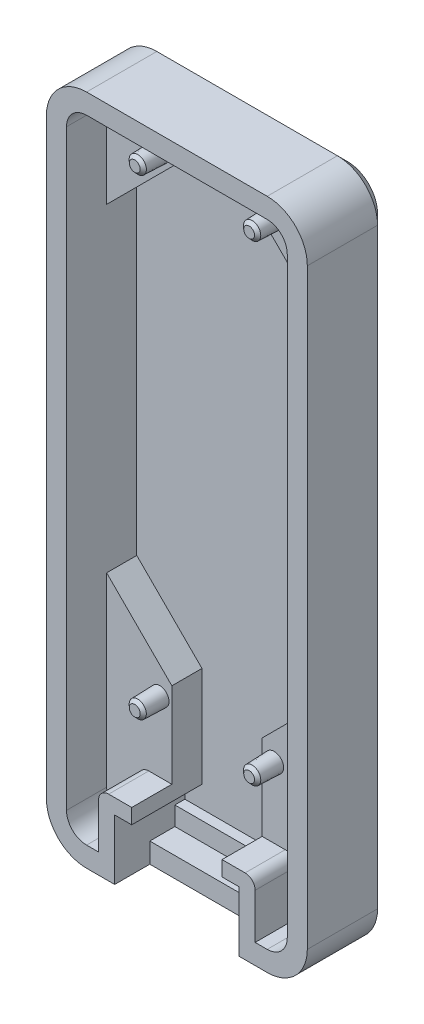
from build123d import *

# Parameters (mm, degrees)
BOSS_EXTRUDE1_DEPTH = 8
BOSS_EXTRUDE2_DEPTH = 1
SKETCH3_W           = 12.400024414
SKETCH3_H           = 1.862224361
BOSS_EXTRUDE3_DEPTH = 1
SKETCH6_R           = 0.85
SKETCH5_R           = 1.004760965
SKETCH5_4_R         = 1.00476126
SKETCH6_4_R         = 0.85
SKETCH6_6_R         = 0.85
SKETCH5_6_R         = 1.004762062
CHAMFER1_SIZE       = 0.3
CHAMFER1_SIZE_2     = 0.310868543
CHAMFER1_SIZE_3     = 0.304224899
CHAMFER1_SIZE_4     = 0.310868565
CHAMFER1_SIZE_5     = 0.310868624
CHAMFER2_SIZE       = 1
SKETCH7_W           = 12.400024414
SKETCH7_H           = 3.5
CUT_EXTRUDE1_DEPTH  = 3
BOSS_EXTRUDE4_DEPTH = 2


with BuildPart() as part:
    # Sketch1 → Boss-Extrude1 (new body)
    with BuildSketch(Plane.XY):
        with BuildLine():
            Line((162.000045776, 76.259460449), (144.000045776, 76.259460449))
            ThreePointArc((144.000045776, 76.259460449), (141.171618652, 77.431033324), (140.000045776, 80.259460449))
            Line((140.000045776, 80.259460449), (140.000045776, 139.259460449))
            ThreePointArc((140.000045776, 139.259460449), (141.171618652, 142.087887574), (144.000045776, 143.259460449))
            Line((144.000045776, 143.259460449), (162.000045776, 143.259460449))
            ThreePointArc((162.000045776, 143.259460449), (164.828472901, 142.087887574), (166.000045776, 139.259460449))
            Line((166.000045776, 139.259460449), (166.000045776, 80.259460449))
            ThreePointArc((166.000045776, 80.259460449), (164.828472901, 77.431033324), (162.000045776, 76.259460449))
        make_face()
        with BuildLine():
            Line((162.000045776, 78.259460449), (160.800048828, 78.259460449))
            Line((160.800048828, 78.259460449), (160.800048828, 82.759460449))
            ThreePointArc((160.800048828, 82.759460449), (160.507155609, 83.46656723), (159.800048828, 83.759460449))
            Line((159.800048828, 83.759460449), (157.500045776, 83.759460449))
            Line((157.500045776, 83.759460449), (157.500045776, 82.259460449))
            Line((157.500045776, 82.259460449), (159.200057983, 82.259460449))
            Line((159.200057983, 82.259460449), (159.200057983, 78.259460449))
            Line((159.200057983, 78.259460449), (146.800033569, 78.259460449))
            Line((146.800033569, 78.259460449), (146.800033569, 82.259460449))
            Line((146.800033569, 82.259460449), (148.500045776, 82.259460449))
            Line((148.500045776, 82.259460449), (148.500045776, 83.759460449))
            Line((148.500045776, 83.759460449), (146.200042725, 83.759460449))
            ThreePointArc((146.200042725, 83.759460449), (145.492935943, 83.46656723), (145.200042725, 82.759460449))
            Line((145.200042725, 82.759460449), (145.200042725, 78.259460449))
            Line((145.200042725, 78.259460449), (144.000045776, 78.259460449))
            ThreePointArc((144.000045776, 78.259460449), (142.585832214, 78.845246887), (142.000045776, 80.259460449))
            Line((142.000045776, 80.259460449), (142.000045776, 139.259460449))
            ThreePointArc((142.000045776, 139.259460449), (142.585832214, 140.673674012), (144.000045776, 141.259460449))
            Line((144.000045776, 141.259460449), (162.000045776, 141.259460449))
            ThreePointArc((162.000045776, 141.259460449), (163.414259339, 140.673674012), (164.000045776, 139.259460449))
            Line((164.000045776, 139.259460449), (164.000045776, 80.259460449))
            ThreePointArc((164.000045776, 80.259460449), (163.414259339, 78.845246887), (162.000045776, 78.259460449))
        make_face(mode=Mode.SUBTRACT)
    extrude(amount=BOSS_EXTRUDE1_DEPTH)

    # Sketch2 → Boss-Extrude2 (add)
    with BuildSketch(Plane(origin=(0, 0, 0), x_dir=(-1, 0, 0), z_dir=(0, 0, -1))):
        with BuildLine():
            Line((-140.000045776, 80.259460449), (-140.000045776, 139.259460449))
            ThreePointArc((-140.000045776, 139.259460449), (-141.171618652, 142.087887574), (-144.000045776, 143.259460449))
            Line((-144.000045776, 143.259460449), (-162.000045776, 143.259460449))
            ThreePointArc((-162.000045776, 143.259460449), (-164.828472901, 142.087887574), (-166.000045776, 139.259460449))
            Line((-166.000045776, 139.259460449), (-166.000045776, 80.259460449))
            ThreePointArc((-166.000045776, 80.259460449), (-164.828472901, 77.431033324), (-162.000045776, 76.259460449))
            Line((-162.000045776, 76.259460449), (-144.000045776, 76.259460449))
            ThreePointArc((-144.000045776, 76.259460449), (-141.171618652, 77.431033324), (-140.000045776, 80.259460449))
        make_face()
    extrude(amount=-BOSS_EXTRUDE2_DEPTH)

    # Sketch3 → Boss-Extrude3 (add)
    with BuildSketch(Plane.XY.offset(1)):
        with BuildLine():
            Line((142.000045776, 130.561752319), (151.345153809, 139.906860352))
            Line((151.345153809, 139.906860352), (154.654937744, 139.906860352))
            Line((154.654937744, 139.906860352), (164.000045776, 130.561736378))
            Line((164.000045776, 130.561736378), (164.000045776, 139.259460449))
            ThreePointArc((164.000045776, 139.259460449), (163.414259339, 140.673674012), (162.000045776, 141.259460449))
            Line((162.000045776, 141.259460449), (144.000045776, 141.259460449))
            ThreePointArc((144.000045776, 141.259460449), (142.585832214, 140.673674012), (142.000045776, 139.259460449))
            Line((142.000045776, 139.259460449), (142.000045776, 130.561752319))
        make_face()
        with BuildLine():
            Line((142.000045776, 98.75945232), (148.500045776, 92.259460449))
            Line((148.500045776, 92.259460449), (148.500045776, 83.759460449))
            Line((148.500045776, 83.759460449), (146.200042725, 83.759460449))
            ThreePointArc((146.200042725, 83.759460449), (145.492935943, 83.46656723), (145.200042725, 82.759460449))
            Line((145.200042725, 82.759460449), (145.200042725, 78.259460449))
            Line((145.200042725, 78.259460449), (144.000045776, 78.259460449))
            ThreePointArc((144.000045776, 78.259460449), (142.585832214, 78.845246887), (142.000045776, 80.259460449))
            Line((142.000045776, 80.259460449), (142.000045776, 98.75945232))
        make_face()
        with BuildLine():
            Line((164.000045776, 80.259460449), (164.000045776, 98.759468579))
            Line((164.000045776, 98.759468579), (157.500045776, 92.259460449))
            Line((157.500045776, 92.259460449), (157.500045776, 83.759460449))
            Line((157.500045776, 83.759460449), (159.800048828, 83.759460449))
            ThreePointArc((159.800048828, 83.759460449), (160.507155609, 83.46656723), (160.800048828, 82.759460449))
            Line((160.800048828, 82.759460449), (160.800048828, 78.259460449))
            Line((160.800048828, 78.259460449), (162.000045776, 78.259460449))
            ThreePointArc((162.000045776, 78.259460449), (163.414259339, 78.845246887), (164.000045776, 80.259460449))
        make_face()
        with Locations((153.000045776, 79.190572629)):
            Rectangle(SKETCH3_W, SKETCH3_H)
    extrude(amount=BOSS_EXTRUDE3_DEPTH)

    # Sketch6 → Loft2 section 0
    with BuildSketch(Plane.XY.offset(6.5)):
        with Locations((158.700035969, 90.759458357)):
            Circle(SKETCH6_R)
    # Sketch5 → Loft2 section 1
    with BuildSketch(Plane.XY.offset(2)):
        with Locations((158.700035969, 90.759458357)):
            Circle(SKETCH5_R)
    loft()

    # Loft3: read off the stored shape, not the designer's step
    # Loft3: loft between two sections, ruled curve by curve
    loft3_from = [
        Edge.make_bspline([(147.444109371, 89.765077917, 2), (149.432868581, 90.053221641, 2), (149.144724857, 92.041980852, 2), (147.155965647, 91.753837127, 2), (145.167206436, 91.465693402, 2), (145.455350161, 89.476934192, 2), (147.444109371, 89.765077917, 2)], [0, 0, 0, 0, 0.5, 0.5, 0.5, 1, 1, 1, 1], 3, [1, 0.333333333, 0.333333333, 1, 0.333333333, 0.333333333, 1]),
    ]
    loft3_to = [
        Edge.make_bspline([(147.763577739, 90.046975624, 6.5), (149.188541535, 90.974056083, 6.5), (148.261461076, 92.39901988, 6.5), (146.836497279, 91.47193942, 6.5), (145.411533483, 90.544858961, 6.5), (146.338613942, 89.119895164, 6.5), (147.763577739, 90.046975624, 6.5)], [0, 0, 0, 0, 0.5, 0.5, 0.5, 1, 1, 1, 1], 3, [1, 0.333333333, 0.333333333, 1, 0.333333333, 0.333333333, 1]),
    ]
    loft3 = Solid(Shell([*[Face.make_surface_from_curves(loft3_from[k], loft3_to[k]) for k in range(1)], Face(Wire(loft3_from)), Face(Wire(loft3_to))]))
    add(loft3)

    # Sketch5<4> → Loft4 section 0
    with BuildSketch(Plane.XY.offset(2)):
        with Locations((158.700040262, 137.759458688)):
            Circle(SKETCH5_4_R)
    # Sketch6<4> → Loft4 section 1
    with BuildSketch(Plane.XY.offset(6.5)):
        with Locations((158.700040262, 137.759458688)):
            Circle(SKETCH6_4_R)
    loft()

    # Sketch6<6> → Loft5 section 0
    with BuildSketch(Plane.XY.offset(6.5)):
        with Locations((147.300037543, 137.759459976)):
            Circle(SKETCH6_6_R)
    # Sketch5<6> → Loft5 section 1
    with BuildSketch(Plane.XY.offset(2)):
        with Locations((147.300037543, 137.759459976)):
            Circle(SKETCH5_6_R)
    loft()

    # Chamfer1
    # the kernel refuses this chamfer: 0.310868624, 0.310868565, 0.310868543, 0.304224899, 0.3 mm, written as the material it takes off along each edge
    with BuildSketch(Plane(origin=(158.700035969, 90.759458357, 6.5), x_dir=(1, 0, 0), z_dir=(0, -1, 0))) as chamfer1_piece_1:
        Polygon((0.85 + CHAMFER1_SIZE * 0.0343710051368, -CHAMFER1_SIZE * 0.999409142447), (0.85 - CHAMFER1_SIZE_2 * 1.00000000105, 0), (0.85, 0), align=None)
    revolve(axis=Axis((158.700035969, 90.759458357, 6.5), (0, 0, 1)), mode=Mode.SUBTRACT)
    with BuildSketch(Plane(origin=(147.300037509, 90.759457522, 6.5), x_dir=(0.5453414472456917, -0.83821399768554, 0), z_dir=(-0.83821399768554, -0.5453414472456917, 0))) as chamfer1_piece_2:
        with BuildLine():
            Line((0.85 + CHAMFER1_SIZE * 0.0153320660096, -CHAMFER1_SIZE * 0.999882456968), (0.85 - CHAMFER1_SIZE_3, 0))
            Line((0.85 - CHAMFER1_SIZE_3, 0), (0.85, 0))
            ThreePointArc((0.85, 0), (0.852250758, -0.154289578), (0.85 + CHAMFER1_SIZE * 0.0153320660096, -CHAMFER1_SIZE * 0.999882456968))
        make_face()
    revolve(axis=Axis((147.300037509, 90.759457522, 6.5), (0, 0, 1)), mode=Mode.SUBTRACT)
    with BuildSketch(Plane(origin=(158.700040262, 137.759458688, 6.5), x_dir=(1, 0, 0), z_dir=(0, -1, 0))) as chamfer1_piece_3:
        Polygon((0.85 + CHAMFER1_SIZE * 0.0343710705269, -CHAMFER1_SIZE * 0.999409140198), (0.85 - CHAMFER1_SIZE_4, 0), (0.85, 0), align=None)
    revolve(axis=Axis((158.700040262, 137.759458688, 6.5), (0, 0, 1)), mode=Mode.SUBTRACT)
    with BuildSketch(Plane(origin=(147.300037543, 137.759459976, 6.5), x_dir=(1, 0, 0), z_dir=(0, -1, 0))) as chamfer1_piece_4:
        Polygon((0.85 + CHAMFER1_SIZE * 0.0343712486304, -CHAMFER1_SIZE * 0.999409134073), (0.85 - CHAMFER1_SIZE_5 * 1.00000000148, 0), (0.85, 0), align=None)
    revolve(axis=Axis((147.300037543, 137.759459976, 6.5), (0, 0, 1)), mode=Mode.SUBTRACT)

    # Chamfer2
    chamfer2_edges = [part.edges().sort_by_distance(p)[0] for p in [
        (166.000045776, 109.759460449, 0),
        (164.828472901, 77.431033324, 0),
        (153.000045776, 76.259460449, 0),
        (141.171618652, 77.431033324, 0),
        (140.000045776, 109.759460449, 0),
        (141.171618652, 142.087887574, 0),
        (153.000045776, 143.259460449, 0),
        (164.828472901, 142.087887574, 0),
    ]]
    chamfer(chamfer2_edges, length=CHAMFER2_SIZE)

    # Sketch7 → Cut-Extrude1 (cut)
    with BuildSketch(Plane.XZ.offset(-76.259460449)):
        with Locations((153.000045776, 6.25)):
            Rectangle(SKETCH7_W, SKETCH7_H)
    extrude(amount=-CUT_EXTRUDE1_DEPTH, mode=Mode.SUBTRACT)

    # Sketch8 → Boss-Extrude4 (add)
    with BuildSketch(Plane.XY.offset(2)):
        with BuildLine():
            Line((162.000045776, 141.259460449), (144.000045776, 141.259460449))
            ThreePointArc((144.000045776, 141.259460449), (142.585832214, 140.673674012), (142.000045776, 139.259460449))
            Line((142.000045776, 139.259460449), (142.000045776, 130.561752319))
            Line((142.000045776, 130.561752319), (151.345153809, 139.906860352))
            Line((151.345153809, 139.906860352), (154.654937744, 139.906860352))
            Line((154.654937744, 139.906860352), (164.000045776, 130.561736378))
            Line((164.000045776, 130.561736378), (164.000045776, 139.259460449))
            ThreePointArc((164.000045776, 139.259460449), (163.414259339, 140.673674012), (162.000045776, 141.259460449))
        make_face()
        with BuildLine():
            Line((164.000045776, 80.259460449), (164.000045776, 98.759468579))
            Line((164.000045776, 98.759468579), (157.500045776, 92.259460449))
            Line((157.500045776, 92.259460449), (157.500045776, 83.759460449))
            Line((157.500045776, 83.759460449), (159.800048828, 83.759460449))
            ThreePointArc((159.800048828, 83.759460449), (160.507155609, 83.46656723), (160.800048828, 82.759460449))
            Line((160.800048828, 82.759460449), (160.800048828, 78.259460449))
            Line((160.800048828, 78.259460449), (162.000045776, 78.259460449))
            ThreePointArc((162.000045776, 78.259460449), (163.414259339, 78.845246887), (164.000045776, 80.259460449))
        make_face()
        with BuildLine():
            Line((146.200042725, 83.759460449), (148.500045776, 83.759460449))
            Line((148.500045776, 83.759460449), (148.500045776, 92.259460449))
            Line((148.500045776, 92.259460449), (142.000045776, 98.75945232))
            Line((142.000045776, 98.75945232), (142.000045776, 80.259460449))
            ThreePointArc((142.000045776, 80.259460449), (142.585832214, 78.845246887), (144.000045776, 78.259460449))
            Line((144.000045776, 78.259460449), (145.200042725, 78.259460449))
            Line((145.200042725, 78.259460449), (145.200042725, 82.759460449))
            ThreePointArc((145.200042725, 82.759460449), (145.492935943, 83.46656723), (146.200042725, 83.759460449))
        make_face()
    extrude(amount=BOSS_EXTRUDE4_DEPTH)


solid = part.part
